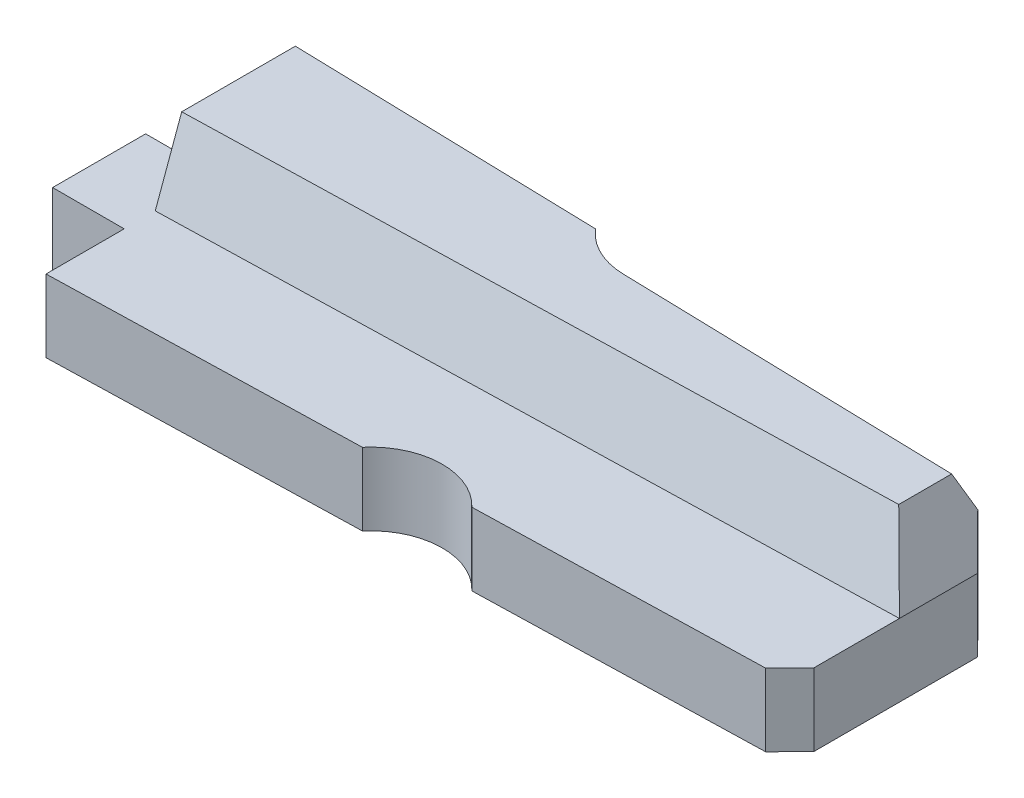
from build123d import *

# Parameters (mm, degrees)
BOSS_EXTRUDE1_DEPTH = 6.08
BOSS_EXTRUDE2_DEPTH = 6.09
SKETCH4_W           = 70.899698082
SKETCH4_H           = 9.313865989
CUT_EXTRUDE4_DEPTH  = 13.09
SKETCH5_W           = 29.305939782
SKETCH5_H           = 12.234342693
CUT_EXTRUDE5_DEPTH  = 19.09
SKETCH6_R           = 6
CUT_EXTRUDE6_DEPTH  = 60.839839878
CUT_EXTRUDE7_DEPTH  = 11.09
SKETCH10_W          = 36.097359295
SKETCH10_H          = 22.987225517
CUT_EXTRUDE11_DEPTH = 63.929843377
SKETCH12_W          = 7.8
SKETCH12_H          = 6.08
BOSS_EXTRUDE4_DEPTH = 6


with BuildPart() as part:
    # Sketch1 → Boss-Extrude1 (new body)
    with BuildSketch(Plane(origin=(0, 0, 0), x_dir=(1, 0, 0), z_dir=(0, 1, 0))):
        Polygon((-14.914047624, 10.796093069), (-14.914047624, -10.733906931), (57.585952376, -8.821379846), (57.585952376, 8.878620154), align=None)
    extrude(amount=BOSS_EXTRUDE1_DEPTH)

    # Sketch2 → Boss-Extrude2 (add)
    with BuildSketch(Plane(origin=(0, 6.08, 0), x_dir=(1, 0, 0), z_dir=(0, 1, 0))):
        Polygon((-13.064047624, 10.74716445), (-13.064047624, -1.521917904), (57.585952376, 0.341806766), (57.585952376, 8.878620154), align=None)
    extrude(amount=BOSS_EXTRUDE2_DEPTH)

    # Sketch4 → Cut-Extrude4 (cut)
    with BuildSketch(Plane(origin=(0.078934537, 1.089467811, 2.992247256), x_dir=(0.9996522376299903, 0, -0.026370510070028146), z_dir=(0.02478017371916596, 0.34202014332566605, 0.9393658310530242))):
        with Locations((22.35021085, 9.967746424)):
            Rectangle(SKETCH4_W, SKETCH4_H)
    extrude(amount=CUT_EXTRUDE4_DEPTH, mode=Mode.SUBTRACT)

    # Sketch5 → Cut-Extrude5 (cut)
    with BuildSketch(Plane(origin=(52.803749931, 19.218993233, 0), x_dir=(0, 0, -1), z_dir=(0.9396926207859081, 0.34202014332566943, 1.2295842975475839e-15))):
        with Locations((0.411188199, -7.865053205)):
            Rectangle(SKETCH5_W, SKETCH5_H)
    extrude(amount=CUT_EXTRUDE5_DEPTH, mode=Mode.SUBTRACT)

    # Sketch6 → Cut-Extrude6 (cut, through all)
    with BuildSketch(Plane.XZ):
        with Locations((27.215952376, 13.62392238)):
            Circle(SKETCH6_R)
        with Locations((27.215952376, -13.683241685)):
            Circle(SKETCH6_R)
        Polygon((-14.914047624, 10.733906931), (-14.914047624, 8.733906931), (-12.914047624, 10.681147563), align=None)
        Polygon((-14.914047624, -10.796093069), (-12.914047624, -10.743197265), (-14.914047624, -8.796093069), align=None)
        Polygon((55.586647901, 8.874120866), (57.585952376, 8.821379846), (57.585952376, 6.821379846), align=None)
        Polygon((57.585952376, -8.878620154), (57.585952376, -6.878620154), (55.585952376, -8.931515959), align=None)
    extrude(amount=-CUT_EXTRUDE6_DEPTH, mode=Mode.SUBTRACT)

    # Sketch7 → Cut-Extrude7 (cut)
    with BuildSketch(Plane(origin=(0.305261026, 5.260141687, -11.541974951), x_dir=(-0.9997105289622884, 0.009976365195544153, -0.021893615951381312), z_dir=(0.024059473814631405, 0.4145836859950284, -0.9096930850712998))):
        Polygon((-26.921663821, 7.88786599), (-26.921663821, 3.064364781), (-63.575410801, 3.466220434), (-63.575410801, 10.38968732), (-26.921663821, 9.987831666), align=None)
    extrude(amount=CUT_EXTRUDE7_DEPTH, mode=Mode.SUBTRACT)

    # Sketch10 → Cut-Extrude11 (cut, through all)
    with BuildSketch(Plane.ZY.offset(3.214047624)):
        with Locations((0.41938451, 3.731019242)):
            Rectangle(SKETCH10_W, SKETCH10_H)
    extrude(amount=CUT_EXTRUDE11_DEPTH, mode=Mode.SUBTRACT)

    # Sketch12 → Boss-Extrude4 (add)
    with BuildSketch(Plane.ZY.offset(3.214047624)):
        with Locations((-0.030693992, 3.04)):
            Rectangle(SKETCH12_W, SKETCH12_H)
    extrude(amount=BOSS_EXTRUDE4_DEPTH)


solid = part.part
